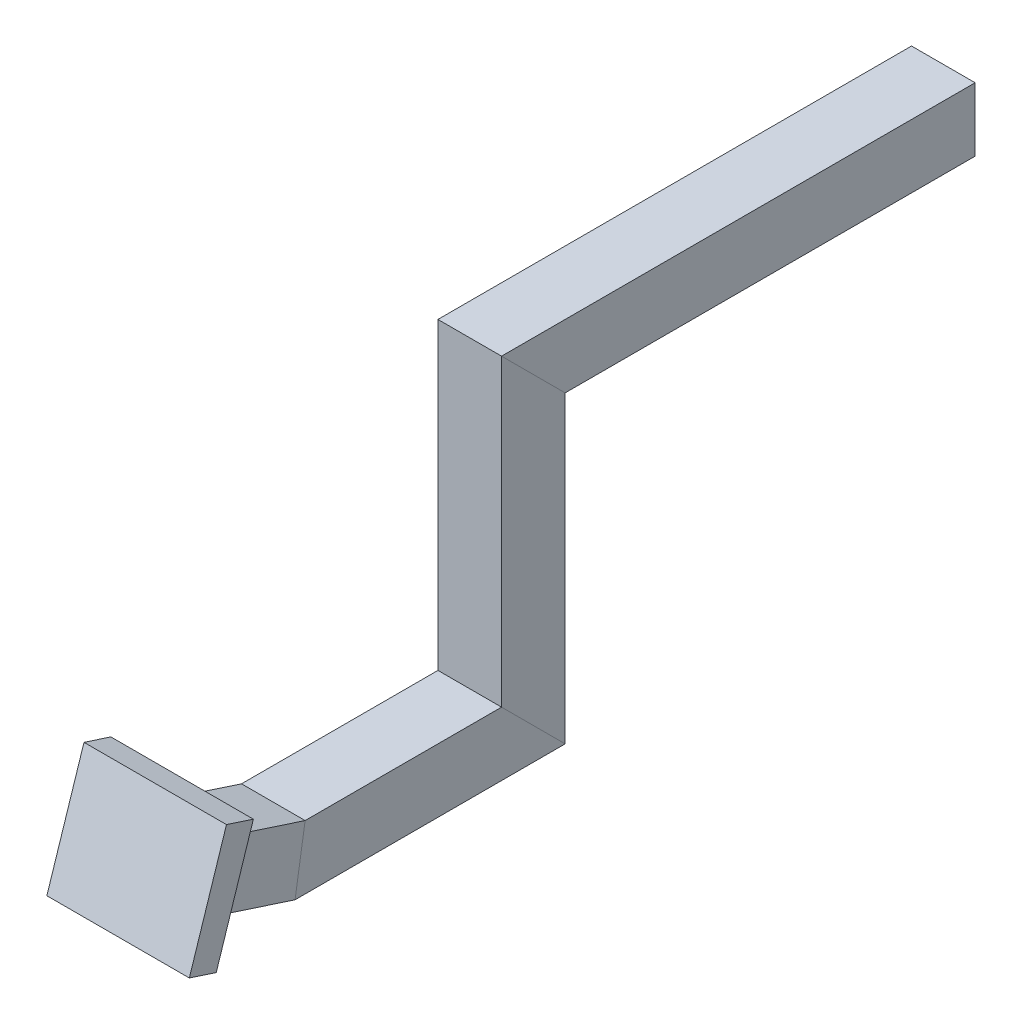
from build123d import *

# Parameters (mm, degrees)
CUT_EXTRUDE3_START         = -17.750008032
CUT_EXTRUDE3_OUTLINE_W     = 3.00000608
CUT_EXTRUDE3_OUTLINE_H     = 30.000001192
CUT_EXTRUDE3_OUTLINE_W_2   = 2.999998629
CUT_EXTRUDE3_DEPTH         = 17.750008032
CUT_EXTRUDE3_2_OUTLINE_W   = 9.999990463
CUT_EXTRUDE3_2_OUTLINE_H   = 30.000001192
CUT_EXTRUDE3_2_OUTLINE_W_2 = 10.000005364
CUT_EXTRUDE3_2_DEPTH       = 3.000000026
CUT_EXTRUDE3_START_2       = -3.000000492
CUT_EXTRUDE3_3_OUTLINE_W   = 12.49999553
CUT_EXTRUDE3_3_OUTLINE_H   = 30.000001192
CUT_EXTRUDE3_3_DEPTH       = 3.000000492
CUT_EXTRUDE3_START_3       = 85.588127375
CUT_EXTRUDE3_4_DEPTH       = 30.000001192
SKETCH7_W                  = 9
SKETCH7_H                  = 9
SKETCH11_W                 = 16.000001486
SKETCH11_H                 = 9
BOSS_EXTRUDE5_DEPTH        = 4
SKETCH12_W                 = 20.155891034
SKETCH12_H                 = 17
BOSS_EXTRUDE6_DEPTH        = 4
CUT_EXTRUDE4_DEPTH         = 20
CUT_EXTRUDE4_DEPTH_BACK    = 20
SKETCH13_W                 = 17.750008032
SKETCH13_H                 = 30.000001192


with BuildPart() as part:
    # Cut-Extrude3: read off the stored shape, not the designer's step
    # Cut-Extrude3 outline → Cut-Extrude3 (new body)
    with BuildSketch(Plane.XY.offset(17.750008032).offset(CUT_EXTRUDE3_START)):
        with Locations((137.970902026, 100.588127971)):
            Rectangle(CUT_EXTRUDE3_OUTLINE_W, CUT_EXTRUDE3_OUTLINE_H)
        with Locations((122.470904142, 100.588127971)):
            Rectangle(CUT_EXTRUDE3_OUTLINE_W_2, CUT_EXTRUDE3_OUTLINE_H)
    extrude(amount=CUT_EXTRUDE3_DEPTH)

    # Cut-Extrude3 2 outline → Cut-Extrude3 2 (add)
    # profile 1 of 2: a face of its own
    with BuildSketch(Plane.XY.offset(17.750008032).offset(CUT_EXTRUDE3_START)):
        with Locations((144.470900298, 100.588127971)):
            Rectangle(CUT_EXTRUDE3_2_OUTLINE_W, CUT_EXTRUDE3_2_OUTLINE_H)
        Polygon((146.020904183, 100.58812052), (145.813241601, 99.813126028), (145.24589479, 99.245779216), (144.470900297, 99.038124084), (143.695905805, 99.245779216), (143.128573895, 99.813126028), (142.920896411, 100.58812052), (143.128573895, 101.363122463), (143.695905805, 101.930469275), (144.470900297, 102.138124406), (145.24589479, 101.930469275), (145.813241601, 101.363122463), align=None, mode=Mode.SUBTRACT)
    # profile 2 of 2: a face of its own
    with BuildSketch(Plane.XY.offset(17.750008032).offset(CUT_EXTRUDE3_START)):
        with Locations((115.970902145, 100.588127971)):
            Rectangle(CUT_EXTRUDE3_2_OUTLINE_W_2, CUT_EXTRUDE3_2_OUTLINE_H)
        Polygon((114.628560841, 101.363122463), (115.195907652, 101.930469275), (115.970902145, 102.138124406), (116.745904088, 101.930469275), (117.313250899, 101.363122463), (117.520906031, 100.58812052), (117.313250899, 99.813126028), (116.745904088, 99.245779216), (115.970902145, 99.038124084), (115.195907652, 99.245779216), (114.628560841, 99.813126028), (114.420905709, 100.58812052), align=None, mode=Mode.SUBTRACT)
    extrude(amount=CUT_EXTRUDE3_2_DEPTH)

    # Cut-Extrude3 3 outline → Cut-Extrude3 3 (add)
    with BuildSketch(Plane.XY.offset(17.750008032).offset(CUT_EXTRUDE3_START_2)):
        with Locations((130.220901221, 100.588127971)):
            Rectangle(CUT_EXTRUDE3_3_OUTLINE_W, CUT_EXTRUDE3_3_OUTLINE_H)
    extrude(amount=CUT_EXTRUDE3_3_DEPTH)

    # Cut-Extrude3 4 outline → Cut-Extrude3 4 (add)
    with BuildSketch(Plane(origin=(0, 0, 0), x_dir=(1, 0, 0), z_dir=(0, 1, 0)).offset(CUT_EXTRUDE3_START_3)):
        Polygon((139.738842845, -4.00000019), (140.470907092, -3.267952008), (141.470894217, -3.000000026), (139.470905066, -3.000000026), (139.470905066, -5.000007804), align=None)
        Polygon((118.970900774, -3.000000026), (119.970902801, -3.267952008), (120.702959597, -4.00000019), (120.970904827, -5.000007804), (120.970904827, -3.000000026), align=None)
    extrude(amount=CUT_EXTRUDE3_4_DEPTH)

    # Sweep1: sweep along a path in Sketch5
    with BuildLine(Plane(origin=(130.220903456, 0, 0), x_dir=(0, 0, -1), z_dir=(1, 0, 0))) as sweep1_path:
        Line((-17.750008032, 100.588127971), (-80.246052562, 100.588127971))
        Line((-80.246052562, 100.588127971), (-80.246052562, 57.588127971))
        Line((-80.246052562, 57.588127971), (-113.246052562, 57.588127971))
        Line((-113.246052562, 57.588127971), (-122.756617725, 60.678297914))
    # Sketch7 → Sweep1 (sweep)
    with BuildSketch(Plane.XY.offset(17.750008032)):
        with Locations((130.220904946, 100.588127971)):
            Rectangle(SKETCH7_W, SKETCH7_H)
    sweep(path=sweep1_path.line, transition=Transition.RIGHT)

    # Sketch11 → Boss-Extrude5 (add)
    with BuildSketch(Plane(origin=(0, 41.871526616, 128.867308142), x_dir=(1, 0, 0), z_dir=(0, 0.30901699437494257, 0.9510565162951552))):
        with Locations((126.720904203, 19.77460958)):
            Rectangle(SKETCH11_W, SKETCH11_H)
    extrude(amount=BOSS_EXTRUDE5_DEPTH)

    # Sketch12 → Boss-Extrude6 (add)
    with BuildSketch(Plane(origin=(0, 43.107594593, 132.671534207), x_dir=(1, 0, 0), z_dir=(0, 0.3090169943749432, 0.951056516295155))):
        with Locations((128.72090495, 19.77460958)):
            Rectangle(SKETCH12_W, SKETCH12_H)
    extrude(amount=BOSS_EXTRUDE6_DEPTH)

    # Sketch13 → Cut-Extrude4 (cut, two sides: drawn at the far end of the back side and taken through both)
    with BuildSketch(Plane(origin=(130.220903456, 0, 0), x_dir=(0, 0, -1), z_dir=(1, 0, 0)).offset(-CUT_EXTRUDE4_DEPTH_BACK)):
        with Locations((-8.875004016, 100.588127971)):
            Rectangle(SKETCH13_W, SKETCH13_H)
    extrude(amount=CUT_EXTRUDE4_DEPTH + CUT_EXTRUDE4_DEPTH_BACK, mode=Mode.SUBTRACT)


solid = part.part
